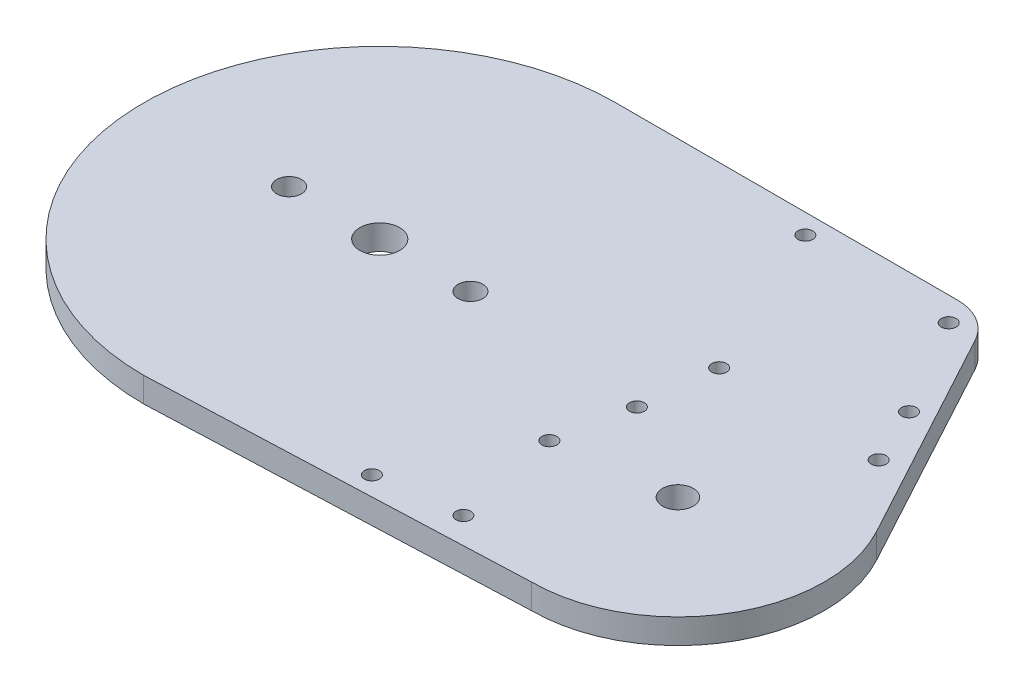
from build123d import *

# Parameters (mm, degrees)
SKETCH1_R           = 4
SKETCH1_R_2         = 1.5
SKETCH1_R_3         = 2.5
SKETCH1_R_4         = 3.1
BOSS_EXTRUDE1_DEPTH = 5


with BuildPart() as part:
    # Sketch1 → Boss-Extrude1 (new body)
    with BuildSketch(Plane(origin=(0, 0, 0), x_dir=(1, 0, 0), z_dir=(0, 1, 0))):
        with BuildLine():
            Line((0, -47.5), (75, -44.5))
            ThreePointArc((75, -44.5), (100.341650726, -30.101348895), (100.945295539, -0.961067014))
            Line((100.945295539, -0.961067014), (77.559049402, 42.258960334))
            ThreePointArc((77.559049402, 42.258960334), (73.883135286, 46.090390077), (68.764033965, 47.5))
            Line((68.764033965, 47.5), (0, 47.5))
            ThreePointArc((0, 47.5), (-47.5, 0), (0, -47.5))
        make_face()
        Circle(SKETCH1_R, mode=Mode.SUBTRACT)
        with Locations((55.143914262, -3.392422339)):
            Circle(SKETCH1_R_2, mode=Mode.SUBTRACT)
        with Locations((52.206852526, -18.077731019)):
            Circle(SKETCH1_R_2, mode=Mode.SUBTRACT)
        with Locations((18.25, 0)):
            Circle(SKETCH1_R_3, mode=Mode.SUBTRACT)
        with Locations((-18.25, 0)):
            Circle(SKETCH1_R_3, mode=Mode.SUBTRACT)
        with Locations((75, -15)):
            Circle(SKETCH1_R_4, mode=Mode.SUBTRACT)
        with Locations((71.835494757, 42.654234046)):
            Circle(SKETCH1_R_2, mode=Mode.SUBTRACT)
        with Locations((83.354686129, 23.142870245)):
            Circle(SKETCH1_R_2, mode=Mode.SUBTRACT)
        with Locations((42.137334928, 43.5)):
            Circle(SKETCH1_R_2, mode=Mode.SUBTRACT)
        with Locations((40.293422434, -41.885064382)):
            Circle(SKETCH1_R_2, mode=Mode.SUBTRACT)
        with Locations((56.591696316, 11.71100727)):
            Circle(SKETCH1_R_2, mode=Mode.SUBTRACT)
        with Locations((88.688017257, 11.71100727)):
            Circle(SKETCH1_R_2, mode=Mode.SUBTRACT)
        with Locations((56.591696316, -39.768646015)):
            Circle(SKETCH1_R_2, mode=Mode.SUBTRACT)
    extrude(amount=BOSS_EXTRUDE1_DEPTH)


solid = part.part
